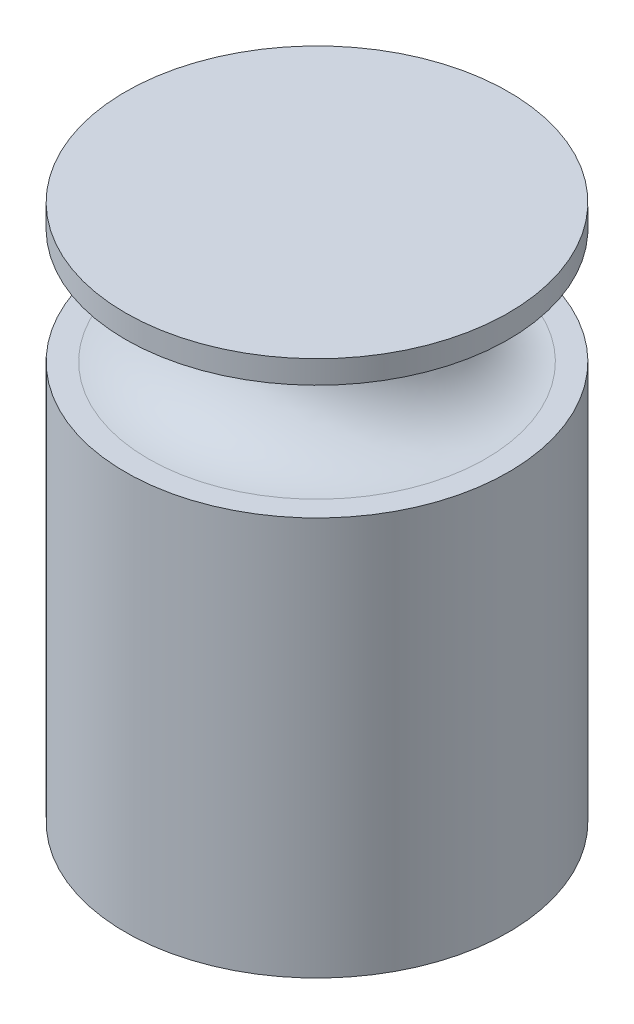
from build123d import *

# Parameters (mm, degrees)
SKETCH1_R           = 25
BOSS_EXTRUDE1_DEPTH = 52
SKETCH2_R           = 12
BOSS_EXTRUDE2_DEPTH = 15
SKETCH3_R           = 25
BOSS_EXTRUDE3_DEPTH = 3
FILLET1_R           = 10
FILLET2_R           = 10
SKETCH4_R           = 20
CUT_EXTRUDE1_DEPTH  = 18


with BuildPart() as part:
    # Sketch1 → Boss-Extrude1 (new body)
    with BuildSketch(Plane(origin=(0, 0, 0), x_dir=(1, 0, 0), z_dir=(0, 1, 0))):
        with Locations(Location((0, 0, 0), (0, 0, 90))):
            Circle(SKETCH1_R)
    extrude(amount=BOSS_EXTRUDE1_DEPTH)

    # Sketch2 → Boss-Extrude2 (add)
    with BuildSketch(Plane(origin=(0, 52, 0), x_dir=(1, 0, 0), z_dir=(0, 1, 0))):
        with Locations(Location((0, 0, 0), (0, 0, 270))):
            Circle(SKETCH2_R)
    extrude(amount=BOSS_EXTRUDE2_DEPTH)

    # Sketch3 → Boss-Extrude3 (add)
    with BuildSketch(Plane(origin=(0, 67, 0), x_dir=(1, 0, 0), z_dir=(0, 1, 0))):
        with Locations(Location((0, 0, 0), (0, 0, 90))):
            Circle(SKETCH3_R)
    extrude(amount=BOSS_EXTRUDE3_DEPTH)

    # Fillet1
    fillet1_edges = [part.edges().sort_by_distance(p)[0] for p in [
        (0, 52, -12),
    ]]
    fillet(fillet1_edges, radius=FILLET1_R)

    # Fillet2
    # the kernel refuses this fillet: 10 mm, written as the material it adds along each edge
    with BuildSketch(Plane(origin=(0, 67, 0), x_dir=(0, 0, 1), z_dir=(-1, 0, 0))) as fillet2_piece_1:
        with BuildLine():
            CenterArc((20.660254038, -10), FILLET2_R, 90, 60)
            Line((20.660254038, 0), (20.660254038, 0.2))
            Line((20.660254038, 0.2), (12, 0.2))
            Line((12, 0.2), (11.8, 0))
            ThreePointArc((11.8, 0), (11.8, -2.5), (11.826794919, -4.9))
            Line((11.826794919, -4.9), (12, -5))
        make_face()
    revolve(axis=Axis((0, 67, 0), (0, 1, 0)))

    # Sketch4 → Cut-Extrude1 (cut)
    with BuildSketch(Plane(origin=(0, 0, 0), x_dir=(-1, 0, 0), z_dir=(0, -1, 0))):
        with Locations(Location((0, 0, 0), (0, 0, 90))):
            Circle(SKETCH4_R)
    extrude(amount=-CUT_EXTRUDE1_DEPTH, mode=Mode.SUBTRACT)


solid = part.part
